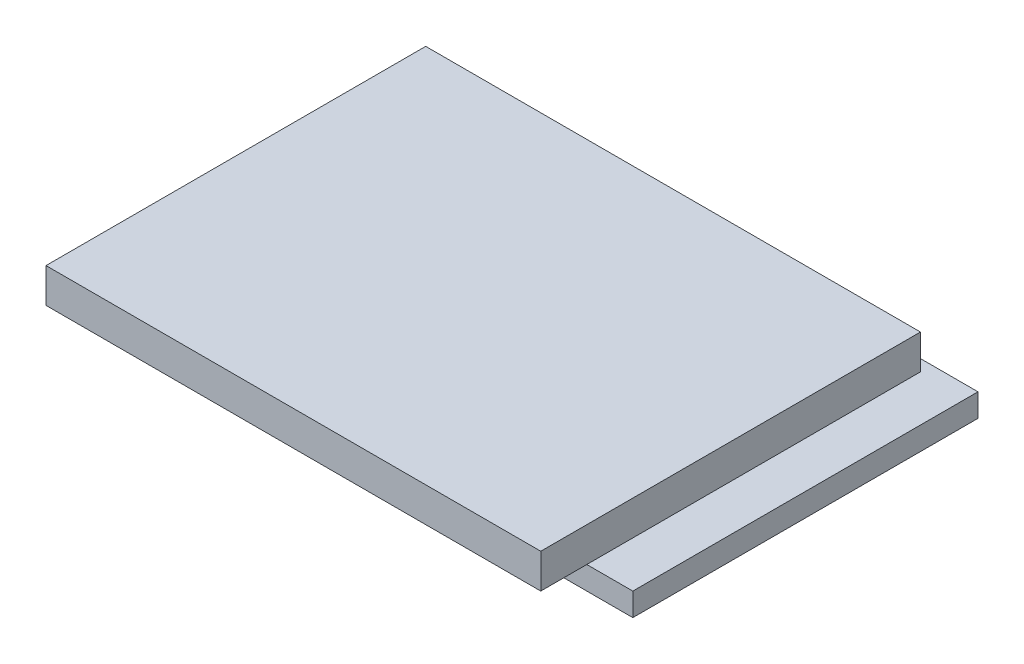
from build123d import *

# Parameters (mm, degrees)
SKETCH1_W           = 48
SKETCH1_H           = 30
BOSS_EXTRUDE1_DEPTH = 2
SKETCH2_W           = 43
SKETCH2_H           = 33
BOSS_EXTRUDE2_DEPTH = 3
SKETCH3_W           = 5.491242003
SKETCH3_H           = 3
BOSS_EXTRUDE3_DEPTH = 5
SKETCH4_R           = 1
CUT_EXTRUDE1_DEPTH  = 52.86520992


with BuildPart() as part:
    # Sketch1 → Boss-Extrude1 (new body)
    with BuildSketch(Plane(origin=(0, 0, 0), x_dir=(1, 0, 0), z_dir=(0, 1, 0))):
        with Locations((24, -15)):
            Rectangle(SKETCH1_W, SKETCH1_H)
    extrude(amount=BOSS_EXTRUDE1_DEPTH)

    # Sketch2 → Boss-Extrude2 (add)
    with BuildSketch(Plane(origin=(0, 2, 0), x_dir=(1, 0, 0), z_dir=(0, 1, 0))):
        with Locations((22.5, -17.5)):
            Rectangle(SKETCH2_W, SKETCH2_H)
    extrude(amount=BOSS_EXTRUDE2_DEPTH)

    # Sketch3 → Boss-Extrude3 (add)
    with BuildSketch(Plane.XZ):
        with Locations((27.834801154, 13.5)):
            Rectangle(SKETCH3_W, SKETCH3_H)
    extrude(amount=BOSS_EXTRUDE3_DEPTH)

    # Sketch4 → Cut-Extrude1 (cut, through all)
    with BuildSketch(Plane.XY.offset(15)):
        with Locations((27.560182347, -2.619839314)):
            Circle(SKETCH4_R)
    extrude(amount=-CUT_EXTRUDE1_DEPTH, mode=Mode.SUBTRACT)


solid = part.part
